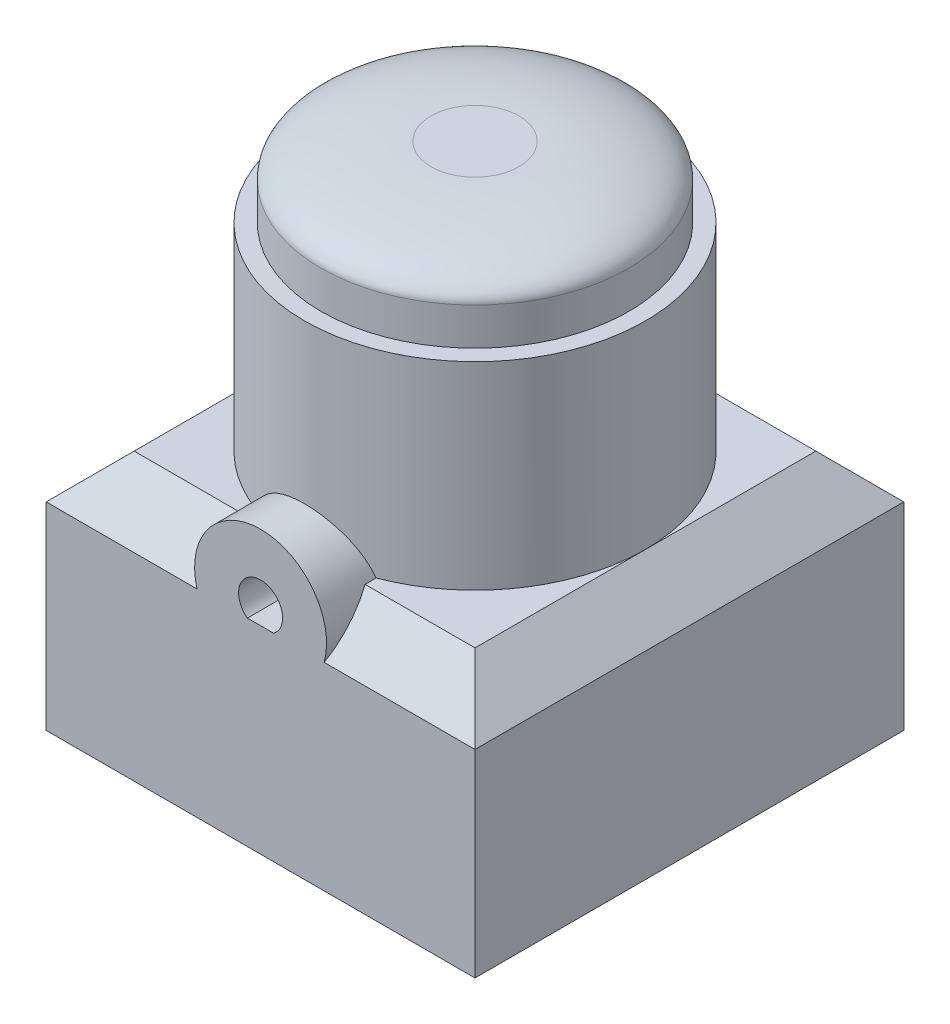
from build123d import *

# Parameters (mm, degrees)
SKETCH1_W           = 19.5
SKETCH1_H           = 19.5
BOSS_EXTRUDE1_DEPTH = 11
SKETCH2_R           = 7.75
BOSS_EXTRUDE2_DEPTH = 9
SKETCH3_R           = 7
BOSS_EXTRUDE3_DEPTH = 3.2
FILLET1_SIZE        = 1.5
FILLET1_SIZE_2      = 5
CHAMFER1_SIZE       = 2
BOSS_EXTRUDE8_REACH = 33.836
SKETCH4_R           = 3
SKETCH4_R_2         = 1
CUT_EXTRUDE1_DEPTH  = 3.2


# Some blends are built 0.0001 mm under size
with BuildPart() as part:
    # Sketch1 → Boss-Extrude1 (new body)
    with BuildSketch(Plane(origin=(0, 0, 0), x_dir=(1, 0, 0), z_dir=(0, 1, 0))):
        Rectangle(SKETCH1_W, SKETCH1_H)
    extrude(amount=BOSS_EXTRUDE1_DEPTH)

    # Sketch2 → Boss-Extrude2 (add)
    with BuildSketch(Plane(origin=(0, 11, 0), x_dir=(1, 0, 0), z_dir=(0, 1, 0))):
        with Locations(Location((0, 0, 0), (0, 0, 270))):
            Circle(SKETCH2_R)
    extrude(amount=BOSS_EXTRUDE2_DEPTH)

    # Sketch3 → Boss-Extrude3 (add)
    with BuildSketch(Plane(origin=(0, 20, 0), x_dir=(1, 0, 0), z_dir=(0, 1, 0))):
        with Locations(Location((0, 0, 0), (0, 0, 270))):
            Circle(SKETCH3_R)
    extrude(amount=BOSS_EXTRUDE3_DEPTH)

    # Fillet1
    # an asymmetric fillet: 5, 1.5 mm, written as the material it takes off along each edge
    with BuildSketch(Plane(origin=(0, 23.2, 0), x_dir=(0, 0, 1), z_dir=(-1, 0, 0))) as fillet1_piece_1:
        with BuildLine():
            Bezier((7, -FILLET1_SIZE), (7, 0), (7 - FILLET1_SIZE_2, 0), weights=[1, 0.707106781, 1])
            Line((7 - FILLET1_SIZE_2, 0), (7, 0))
            Line((7, 0), (7, -FILLET1_SIZE))
        make_face()
    revolve(axis=Axis((0, 23.2, 0), (0, 1, 0)), mode=Mode.SUBTRACT)

    # Chamfer1
    chamfer1_edges = [part.edges().sort_by_distance(p)[0] for p in [
        (-9.75, 11, 0),
        (0, 11, 9.75),
        (9.75, 11, 0),
        (0, 11, -9.75),
    ]]
    chamfer(chamfer1_edges, length=CHAMFER1_SIZE - 0.0001)  # a hair under: the kernel refuses the full size

    # Sketch4 → Boss-Extrude8 (add, up to next)
    with BuildSketch(Plane.XY.offset(9.75), mode=Mode.PRIVATE) as boss_extrude8_sk1:
        with Locations((0, 9.8)):
            Circle(SKETCH4_R)
        with Locations((0, 9.8)):
            Circle(SKETCH4_R_2, mode=Mode.SUBTRACT)
    boss_extrude8_tool1 = extrude(boss_extrude8_sk1.sketch, amount=-BOSS_EXTRUDE8_REACH, mode=Mode.PRIVATE) - part.part
    add(boss_extrude8_tool1.solids().sort_by_distance((-2.915147, 9.8, 9.75))[0])

    # Sketch5 → Cut-Extrude1 (cut)
    with BuildSketch(Plane.XY.offset(9.75)):
        with BuildLine():
            Line((0.6, 9), (-0.6, 9))
            ThreePointArc((-0.6, 9), (0, 10.8), (0.6, 9))
        make_face()
    extrude(amount=-CUT_EXTRUDE1_DEPTH, mode=Mode.SUBTRACT)


solid = part.part
